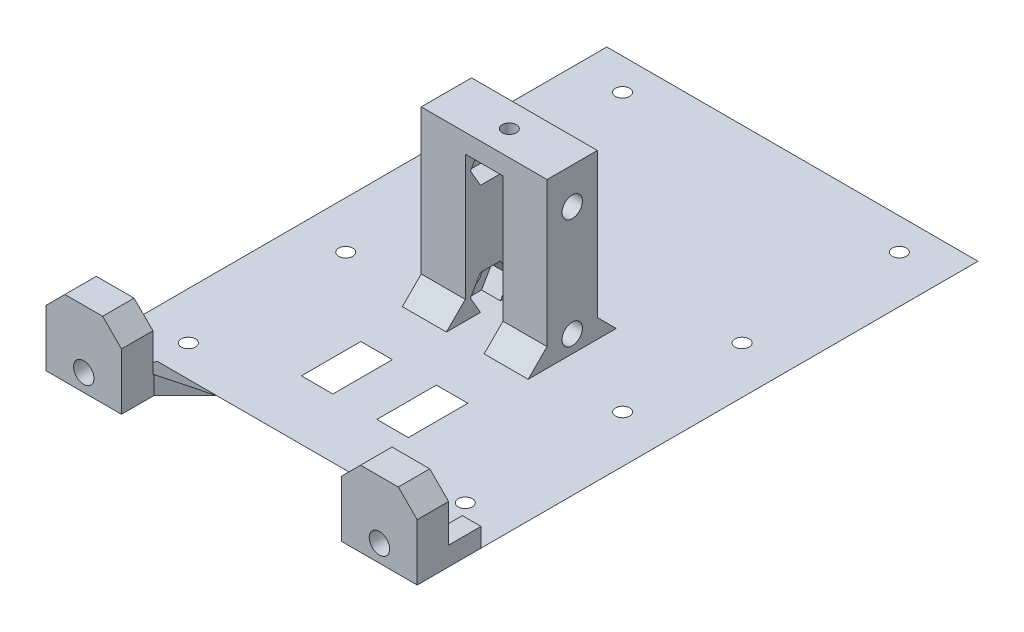
from build123d import *

# Parameters (mm, degrees)
BASE_DEPTH                     = 0.001
SKETCH1_W                      = 20
SKETCH1_H                      = 7
SKETCH1_H_2                    = 8
SKETCH1_W_2                    = 7
SKETCH1_H_3                    = 38.5
SOPORTE_MOTORES_DEPTH          = 23
SOPORTE_PALA_DEPTH             = 84.783035433
SKETCH3_R                      = 1.625
AGUJEROS_MOTORES_DEPTH         = 72.406211399
SKETCH4_R                      = 1
AGUJEROS_PALA_DEPTH            = 4
HUECO_SOPORTE_POSTERIOR_DEPTH  = 10
CORTE_SOPORTE_PALA_MOTOR_REACH = 70.026
BOSS_EXTRUDE2_DEPTH            = 20
CHAMFER1_SIZE                  = 3
CORTAR_EXTRUIR1_DEPTH          = 84.783035433
CORTAR_EXTRUIR1_DEPTH_BACK     = 84.783035433
SALIENTE_EXTRUIR1_START        = -59
SALIENTE_EXTRUIR1_DEPTH        = 12
SALIENTE_EXTRUIR2_DEPTH        = 12
CHAFL_N1_SIZE                  = 5
CROQUIS7_R                     = 1.625
CORTAR_EXTRUIR2_DEPTH          = 12
CORTAR_EXTRUIR3_DEPTH          = 15
CORTAR_EXTRUIR3_DEPTH_BACK     = 2.5
CORTAR_EXTRUIR5_DEPTH          = 85.868726303
CORTAR_EXTRUIR5_DEPTH_BACK     = 85.868726303
CROQUIS10_W                    = 13.75510153
CROQUIS10_H                    = 28.013777128
SALIENTE_EXTRUIR3_START        = -20
CROQUIS11_W                    = 8
CROQUIS11_H                    = 3
SALIENTE_EXTRUIR3_DEPTH        = 20
CORTAR_EXTRUIR6_START          = -11
CROQUIS12_W                    = 6
CROQUIS12_H                    = 23
CORTAR_EXTRUIR6_DEPTH          = 14
CORTAR_EXTRUIR7_DEPTH          = 9
CORTAR_EXTRUIR7_DEPTH_BACK     = 3
CHAFL_N2_SIZE                  = 3
CORTAR_EXTRUIR8_REACH          = 70.84
CROQUIS15_R                    = 1.125
CROQUIS16_R                    = 1.125
CORTAR_EXTRUIR9_DEPTH          = 69.839702957


with BuildPart() as part:
    # Croquis1 → Base (new body)
    with BuildSketch(Plane(origin=(0, 0, 10.887020736), x_dir=(1, 0, 0), z_dir=(0, 1, 0))):
        Polygon((-29.5, 32.640625), (29.5, 32.640625), (29.5, -47.359375), (8.5, -47.359375), (8.5, -27.453125), (3.5, -27.453125), (3.5, -47.359375), (-3.5, -47.359375), (-3.5, -27.453125), (-8.5, -27.453125), (-8.5, -47.359375), (-29.5, -47.359375), align=None)
    extrude(amount=BASE_DEPTH)

    # Sketch1 → Soporte Motores (add)
    with BuildSketch(Plane(origin=(0, 0.001, 10.887020736), x_dir=(1, 0, 0), z_dir=(0, 1, 0))):
        with Locations((0, 19.640625)):
            Rectangle(SKETCH1_W, SKETCH1_H)
        with Locations((0, -12.359375)):
            Rectangle(SKETCH1_W, SKETCH1_H_2)
        with Locations((0, -35.609375)):
            Rectangle(SKETCH1_W_2, SKETCH1_H_3)
    extrude(amount=SOPORTE_MOTORES_DEPTH)

    # Sketch2 → Soporte Pala (cut, through all)
    with BuildSketch(Plane(origin=(29.5, 0, 10.887020736), x_dir=(0, 0, -1), z_dir=(1, 0, 0))):
        Polygon((-54.859375, 23.001), (-46.359375, 0), (-47.359375, 0), (-47.359375, 0.001), (-54.859375, 0.001), align=None)
    extrude(amount=-SOPORTE_PALA_DEPTH, mode=Mode.SUBTRACT)

    # Sketch3 → Agujeros Motores (cut, through all)
    with BuildSketch(Plane(origin=(-10, 0, 10.887020736), x_dir=(0, 0, 1), z_dir=(-1, 0, 0))):
        with Locations((12.359375, 2.751)):
            Circle(SKETCH3_R)
        with Locations((12.359375, 20.251)):
            Circle(SKETCH3_R)
    extrude(amount=-AGUJEROS_MOTORES_DEPTH, mode=Mode.SUBTRACT)

    # Sketch4 → Agujeros pala (cut)
    with BuildSketch(Plane(origin=(0, -15.440118905, 51.540512919), x_dir=(1, 0, 0), z_dir=(0, -0.34663688071515025, 0.9379993992151973))):
        with Locations(Location((0, 21.460691678, 0), (0, 0, 270))):
            Circle(SKETCH4_R)
        with Locations(Location((0, 31.460691678, 0), (0, 0, 270))):
            Circle(SKETCH4_R)
    extrude(amount=-AGUJEROS_PALA_DEPTH, mode=Mode.SUBTRACT)

    # Croquis2 → Hueco Soporte Posterior (cut)
    with BuildSketch(Plane(origin=(0, 0, -12.253604264), x_dir=(-1, 0, 0), z_dir=(0, 0, -1))):
        Polygon((-5, 6), (-5, 0.001), (5, 0.001), (5, 3.001), (5, 18.001), (-5, 18.001), align=None)
    extrude(amount=-HUECO_SOPORTE_POSTERIOR_DEPTH, mode=Mode.SUBTRACT)

    # Croquis3 → Corte_Soporte_PALA_MOTOR (cut, up to next)
    with BuildSketch(Plane(origin=(-3.5, 0, 10.887020736), x_dir=(0, 0, 1), z_dir=(-1, 0, 0)), mode=Mode.PRIVATE) as corte_soporte_pala_motor_sk1:
        Polygon((21.90625, 0.001), (36.90625, 0.001), (36.90625, 23.001), (21.90625, 23.001), (16.359375, 23.001), (16.359375, 0.001), align=None)
    corte_soporte_pala_motor_tool1 = extrude(corte_soporte_pala_motor_sk1.sketch, amount=-CORTE_SOPORTE_PALA_MOTOR_REACH, mode=Mode.PRIVATE) & part.part
    add(corte_soporte_pala_motor_tool1.solids().sort_by_distance((-3.5, 11.501, 37.519833))[0], mode=Mode.SUBTRACT)

    # Sketch5 → Boss-Extrude2 (add)
    with BuildSketch(Plane(origin=(-8.5, 0, 10.887020736), x_dir=(0, 0, -1), z_dir=(1, 0, 0))):
        Polygon((-36.90625, 0.001), (-36.90625, 0), (-46.359375, 0), (-46.359744549, 0.001), align=None)
    extrude(amount=BOSS_EXTRUDE2_DEPTH)

    # Chamfer1
    # the kernel refuses this chamfer: 3 mm, written as the material it adds along each edge
    with BuildSketch(Plane(origin=(10, 0.001, -5.253604264), x_dir=(0, -0.027495876610586372, 0.9996219169112968), z_dir=(-1, 0, 0)), Plane(origin=(5, 0.001, -12.253604264), x_dir=(0, -0.02749587661058642, -0.9996219169112968), z_dir=(1, 0, 0)), Plane(origin=(-5, 0.001, -5.253604264), x_dir=(0, -0.027495876610586372, 0.9996219169112968), z_dir=(-1, 0, 0)), Plane(origin=(-10, 0.001, -12.253604264), x_dir=(0, -0.02749587661058642, -0.9996219169112968), z_dir=(1, 0, 0))) as chamfer1_piece_1:
        Polygon((CHAMFER1_SIZE * 0.999621916911, CHAMFER1_SIZE * 0.0274958766106), (-CHAMFER1_SIZE * 0.0274958766106, CHAMFER1_SIZE * 0.999621916911), (0, 0), align=None)
    extrude(amount=5)
    with BuildSketch(Plane(origin=(-5, 0.001, -12.253604264), x_dir=(0.9996219169112968, -0.027495876610586372, 0), z_dir=(0, 0, 1))) as chamfer1_piece_2:
        Polygon((CHAMFER1_SIZE * 0.999621916911, CHAMFER1_SIZE * 0.0274958766106), (-CHAMFER1_SIZE * 0.0274958766106, CHAMFER1_SIZE * 0.999621916911), (0, 0), align=None)
    extrude(amount=7)
    with BuildSketch(Plane(origin=(5, 0.001, -12.253604264), x_dir=(-0.9996219169112968, -0.02749587661058637, 0), z_dir=(0, 0, 1))) as chamfer1_piece_3:
        Polygon((CHAMFER1_SIZE * 0.999621916911, -CHAMFER1_SIZE * 0.0274958766106), (-CHAMFER1_SIZE * 0.0274958766106, -CHAMFER1_SIZE * 0.999621916911), (0, 0), align=None)
    extrude(amount=7)
    with BuildSketch(Plane(origin=(-3.5, 0.001, 64.961814249), x_dir=(-0.9996219169112969, -0.027495876610586372, 0), z_dir=(0, 0, -1))) as chamfer1_piece_4_section:
        Polygon((CHAMFER1_SIZE * 0.999621916911, CHAMFER1_SIZE * 0.0274958766106), (-CHAMFER1_SIZE * 0.0274958766106, CHAMFER1_SIZE * 0.999621916911), (0, 0), align=None)
    chamfer1_piece_4 = extrude(amount=17.168543513, mode=Mode.PRIVATE)
    chamfer1_piece_4 = split(chamfer1_piece_4, bisect_by=Plane(origin=(-4.440250326, -0.54073931, 57.046565984), z_dir=(0, 0.34663688071515014, -0.9379993992151971)), keep=Keep.TOP, mode=Mode.PRIVATE)
    chamfer1_piece_4 = split(chamfer1_piece_4, bisect_by=Plane(origin=(-4.440250326, 0, 52.715647697), z_dir=(0, 1, 0)), keep=Keep.TOP, mode=Mode.PRIVATE)
    add(chamfer1_piece_4)
    with BuildSketch(Plane(origin=(3.5, 0.001, 47.793270736), x_dir=(0.9996219169112969, -0.027495876610586372, 0), z_dir=(0, 0, 1))) as chamfer1_piece_5_section:
        Polygon((CHAMFER1_SIZE * 0.999621916911, CHAMFER1_SIZE * 0.0274958766106), (-CHAMFER1_SIZE * 0.0274958766106, CHAMFER1_SIZE * 0.999621916911), (0, 0), align=None)
    chamfer1_piece_5 = extrude(amount=17.168543513, mode=Mode.PRIVATE)
    chamfer1_piece_5 = split(chamfer1_piece_5, bisect_by=Plane(origin=(4.440250326, -0.54073931, 57.046565984), z_dir=(0, 0.34663688071515014, -0.9379993992151971)), keep=Keep.TOP, mode=Mode.PRIVATE)
    chamfer1_piece_5 = split(chamfer1_piece_5, bisect_by=Plane(origin=(4.440250326, 0, 52.715647697), z_dir=(0, 1, 0)), keep=Keep.TOP, mode=Mode.PRIVATE)
    add(chamfer1_piece_5)
    with BuildSketch(Plane(origin=(-10, 0.001, 19.246395736), x_dir=(0, -0.02749587661058636, -0.9996219169112968), z_dir=(1, 0, 0)), Plane(origin=(10, 0.001, 27.246395736), x_dir=(0, -0.02749587661058636, 0.9996219169112968), z_dir=(-1, 0, 0))) as chamfer1_piece_6:
        Polygon((CHAMFER1_SIZE * 0.999621916911, CHAMFER1_SIZE * 0.0274958766106), (-CHAMFER1_SIZE * 0.0274958766106, CHAMFER1_SIZE * 0.999621916911), (0, 0), align=None)
    extrude(amount=20)
    with BuildSketch(Plane(origin=(5, 0.001, -12.253604264), x_dir=(-0.9996219169112968, -0.02749587661058637, 0), z_dir=(0, 0, 1))) as chamfer1_piece_7a_section:
        Polygon((CHAMFER1_SIZE * 0.999621916911, -CHAMFER1_SIZE * 0.0274958766106), (-CHAMFER1_SIZE * 0.0274958766106, -CHAMFER1_SIZE * 0.999621916911), (0, 0), align=None)
    chamfer1_piece_7a = extrude(amount=14.715048964, mode=Mode.PRIVATE)
    chamfer1_piece_7a = split(chamfer1_piece_7a, bisect_by=Plane(origin=(4.01061912, 0.99038088, -5.253604264), z_dir=(0, 0, 1)), keep=Keep.TOP, mode=Mode.PRIVATE)
    with BuildSketch(Plane(origin=(10, 0.001, -5.253604264), x_dir=(0, -0.027495876610586372, 0.9996219169112968), z_dir=(-1, 0, 0))) as chamfer1_piece_7b_section:
        Polygon((CHAMFER1_SIZE * 0.999621916911, CHAMFER1_SIZE * 0.0274958766106), (-CHAMFER1_SIZE * 0.0274958766106, CHAMFER1_SIZE * 0.999621916911), (0, 0), align=None)
    chamfer1_piece_7b = extrude(amount=12.715048964, mode=Mode.PRIVATE)
    chamfer1_piece_7b = split(chamfer1_piece_7b, bisect_by=Plane(origin=(5, 0.99038088, -4.264223383), z_dir=(-1, 0, 0)), keep=Keep.TOP, mode=Mode.PRIVATE)
    chamfer1_piece_7 = chamfer1_piece_7a & chamfer1_piece_7b
    add(chamfer1_piece_7)
    with BuildSketch(Plane(origin=(-2.715048964, 0.001, -12.253604264), x_dir=(0, -0.027495876610586358, -0.9996219169112968), z_dir=(1, 0, 0))) as chamfer1_piece_8a_section:
        Polygon((CHAMFER1_SIZE * 0.999621916911, CHAMFER1_SIZE * 0.0274958766106), (-CHAMFER1_SIZE * 0.0274958766106, CHAMFER1_SIZE * 0.999621916911), (0, 0), align=None)
    chamfer1_piece_8a = extrude(amount=12.715048964, mode=Mode.PRIVATE)
    chamfer1_piece_8a = split(chamfer1_piece_8a, bisect_by=Plane(origin=(5, 0.99038088, -13.242985144), z_dir=(-1, 0, 0)), keep=Keep.TOP, mode=Mode.PRIVATE)
    with BuildSketch(Plane(origin=(5, 0.001, -19.968653228), x_dir=(-0.9996219169112968, -0.02749587661058637, 0), z_dir=(0, 0, 1))) as chamfer1_piece_8b_section:
        Polygon((CHAMFER1_SIZE * 0.999621916911, -CHAMFER1_SIZE * 0.0274958766106), (-CHAMFER1_SIZE * 0.0274958766106, -CHAMFER1_SIZE * 0.999621916911), (0, 0), align=None)
    chamfer1_piece_8b = extrude(amount=14.715048964, mode=Mode.PRIVATE)
    chamfer1_piece_8b = split(chamfer1_piece_8b, bisect_by=Plane(origin=(4.01061912, 0.99038088, -12.253604264), z_dir=(0, 0, -1)), keep=Keep.TOP, mode=Mode.PRIVATE)
    chamfer1_piece_8 = chamfer1_piece_8a & chamfer1_piece_8b
    add(chamfer1_piece_8)
    with BuildSketch(Plane(origin=(-10, 0.001, -12.253604264), x_dir=(0, -0.02749587661058642, -0.9996219169112968), z_dir=(1, 0, 0))) as chamfer1_piece_9a_section:
        Polygon((CHAMFER1_SIZE * 0.999621916911, CHAMFER1_SIZE * 0.0274958766106), (-CHAMFER1_SIZE * 0.0274958766106, CHAMFER1_SIZE * 0.999621916911), (0, 0), align=None)
    chamfer1_piece_9a = extrude(amount=12.715048964, mode=Mode.PRIVATE)
    chamfer1_piece_9a = split(chamfer1_piece_9a, bisect_by=Plane(origin=(-5, 0.99038088, -13.242985144), z_dir=(1, 0, 0)), keep=Keep.TOP, mode=Mode.PRIVATE)
    with BuildSketch(Plane(origin=(-5, 0.001, -19.968653228), x_dir=(0.9996219169112968, -0.027495876610586372, 0), z_dir=(0, 0, 1))) as chamfer1_piece_9b_section:
        Polygon((CHAMFER1_SIZE * 0.999621916911, CHAMFER1_SIZE * 0.0274958766106), (-CHAMFER1_SIZE * 0.0274958766106, CHAMFER1_SIZE * 0.999621916911), (0, 0), align=None)
    chamfer1_piece_9b = extrude(amount=14.715048964, mode=Mode.PRIVATE)
    chamfer1_piece_9b = split(chamfer1_piece_9b, bisect_by=Plane(origin=(-4.01061912, 0.99038088, -12.253604264), z_dir=(0, 0, -1)), keep=Keep.TOP, mode=Mode.PRIVATE)
    chamfer1_piece_9 = chamfer1_piece_9a & chamfer1_piece_9b
    add(chamfer1_piece_9)
    with BuildSketch(Plane(origin=(2.715048964, 0.001, -5.253604264), x_dir=(0, -0.027495876610586372, 0.9996219169112968), z_dir=(-1, 0, 0))) as chamfer1_piece_10a_section:
        Polygon((CHAMFER1_SIZE * 0.999621916911, CHAMFER1_SIZE * 0.0274958766106), (-CHAMFER1_SIZE * 0.0274958766106, CHAMFER1_SIZE * 0.999621916911), (0, 0), align=None)
    chamfer1_piece_10a = extrude(amount=12.715048964, mode=Mode.PRIVATE)
    chamfer1_piece_10a = split(chamfer1_piece_10a, bisect_by=Plane(origin=(-5, 0.99038088, -4.264223383), z_dir=(1, 0, 0)), keep=Keep.TOP, mode=Mode.PRIVATE)
    with BuildSketch(Plane(origin=(-5, 0.001, -12.253604264), x_dir=(0.9996219169112968, -0.027495876610586372, 0), z_dir=(0, 0, 1))) as chamfer1_piece_10b_section:
        Polygon((CHAMFER1_SIZE * 0.999621916911, CHAMFER1_SIZE * 0.0274958766106), (-CHAMFER1_SIZE * 0.0274958766106, CHAMFER1_SIZE * 0.999621916911), (0, 0), align=None)
    chamfer1_piece_10b = extrude(amount=14.715048964, mode=Mode.PRIVATE)
    chamfer1_piece_10b = split(chamfer1_piece_10b, bisect_by=Plane(origin=(-4.01061912, 0.99038088, -5.253604264), z_dir=(0, 0, 1)), keep=Keep.TOP, mode=Mode.PRIVATE)
    chamfer1_piece_10 = chamfer1_piece_10a & chamfer1_piece_10b
    add(chamfer1_piece_10)

    # Croquis4 → Cortar-Extruir1 (cut, two sides: drawn at the far end of the back side and taken through both)
    with BuildSketch(Plane(origin=(-29.5, 0, 10.887020736), x_dir=(0, 0, 1), z_dir=(-1, 0, 0)).offset(-CORTAR_EXTRUIR1_DEPTH_BACK)):
        Polygon((36.90625, 23.001), (36.90625, 0.001), (46.359375, 0.001), (46.359375, 0), (54.859375, 23.001), align=None)
    extrude(amount=CORTAR_EXTRUIR1_DEPTH + CORTAR_EXTRUIR1_DEPTH_BACK, mode=Mode.SUBTRACT)

    # Croquis5 → Saliente-Extruir1 (add)
    with BuildSketch(Plane(origin=(-29.5, 0, 10.887020736), x_dir=(0, 0, 1), z_dir=(-1, 0, 0)).offset(SALIENTE_EXTRUIR1_START)):
        Polygon((46.359375, 0), (56.503581331, 0), (56.503581331, 12), (51.503581331, 12), (51.503581331, 3.001), (46.359375, 3), align=None)
    extrude(amount=SALIENTE_EXTRUIR1_DEPTH)

    # Croquis6 → Saliente-Extruir2 (add)
    with BuildSketch(Plane(origin=(-29.5, 0, 10.887020736), x_dir=(0, 0, 1), z_dir=(-1, 0, 0))):
        Polygon((46.359375, 0.001), (46.359375, 0), (56.503581331, 0), (56.503581331, 12), (51.503581331, 12), (51.503581331, 3.001), align=None)
    extrude(amount=-SALIENTE_EXTRUIR2_DEPTH)

    # Chaflán1
    chafl_n1_edges = [part.edges().sort_by_distance(p)[0] for p in [
        (-17.5, 0.0005, 57.246395736),
        (17.5, 0.0005, 57.246395736),
    ]]
    chamfer(chafl_n1_edges, length=CHAFL_N1_SIZE)

    # Croquis7 → Cortar-Extruir2 (cut)
    with BuildSketch(Plane.XY.offset(67.390602068)):
        with Locations((-23.5, 2.751)):
            Circle(CROQUIS7_R)
        with Locations(Location((23.5, 2.751, 0), (0, 0, 8.814201063))):
            Circle(CROQUIS7_R)
    extrude(amount=-CORTAR_EXTRUIR2_DEPTH, mode=Mode.SUBTRACT)

    # Croquis8 → Cortar-Extruir3 (cut, two sides: drawn at the far end of the back side and taken through both)
    with BuildSketch(Plane(origin=(0, 0, 62.390602068), x_dir=(-1, 0, 0), z_dir=(0, 0, -1)).offset(-CORTAR_EXTRUIR3_DEPTH_BACK)):
        Polygon((-21.91228676, 0.001), (-20.324573519, 2.751), (-21.91228676, 5.501), (-25.08771324, 5.501), (-26.675426481, 2.751), (-25.08771324, 0.001), align=None)
        Polygon((25.08771324, 0.001), (26.675426481, 2.751), (25.08771324, 5.501), (21.91228676, 5.501), (20.324573519, 2.751), (21.91228676, 0.001), align=None)
    extrude(amount=CORTAR_EXTRUIR3_DEPTH + CORTAR_EXTRUIR3_DEPTH_BACK, mode=Mode.SUBTRACT)

    # Croquis10 → Cortar-Extruir5 (cut, two sides: drawn at the far end of the back side and taken through both)
    with BuildSketch(Plane(origin=(-29.5, 0, 10.887020736), x_dir=(0, 0, 1), z_dir=(-1, 0, 0)).offset(-CORTAR_EXTRUIR5_DEPTH_BACK)):
        with Locations((-19.263074235, 14.007888564)):
            Rectangle(CROQUIS10_W, CROQUIS10_H)
    extrude(amount=CORTAR_EXTRUIR5_DEPTH + CORTAR_EXTRUIR5_DEPTH_BACK, mode=Mode.SUBTRACT)

    # Croquis11 → Saliente-Extruir3 (add)
    with BuildSketch(Plane(origin=(-10, 0, 10.887020736), x_dir=(0, 0, 1), z_dir=(-1, 0, 0)).offset(SALIENTE_EXTRUIR3_START)):
        with Locations((12.359375, 24.501)):
            Rectangle(CROQUIS11_W, CROQUIS11_H)
    extrude(amount=SALIENTE_EXTRUIR3_DEPTH)

    # Croquis12 → Cortar-Extruir6 (cut)
    with BuildSketch(Plane(origin=(0, 0, 19.246395736), x_dir=(-1, 0, 0), z_dir=(0, 0, -1)).offset(CORTAR_EXTRUIR6_START)):
        with Locations((0, 11.501)):
            Rectangle(CROQUIS12_W, CROQUIS12_H)
    extrude(amount=CORTAR_EXTRUIR6_DEPTH, mode=Mode.SUBTRACT)

    # Croquis13 → Cortar-Extruir7 (cut, two sides: drawn at the far end of the back side and taken through both)
    with BuildSketch(Plane(origin=(3, 0, 10.887020736), x_dir=(0, 0, 1), z_dir=(-1, 0, 0)).offset(-CORTAR_EXTRUIR7_DEPTH_BACK)):
        Polygon((13.94708824, 0.001), (15.534801481, 2.751), (13.94708824, 5.501), (10.77166176, 5.501), (9.183948519, 2.751), (10.77166176, 0.001), align=None)
        Polygon((13.94708824, 17.501), (15.534801481, 20.251), (13.94708824, 23.001), (10.77166176, 23.001), (9.183948519, 20.251), (10.77166176, 17.501), align=None)
    extrude(amount=CORTAR_EXTRUIR7_DEPTH + CORTAR_EXTRUIR7_DEPTH_BACK, mode=Mode.SUBTRACT)

    # Chaflán2
    chafl_n2_edges = [part.edges().sort_by_distance(p)[0] for p in [
        (29.5, 12, 64.890602068),
        (17.5, 12, 64.890602068),
        (-17.5, 12, 64.890602068),
        (-29.5, 12, 64.890602068),
    ]]
    chamfer(chafl_n2_edges, length=CHAFL_N2_SIZE)

    # Croquis15 → Cortar-Extruir8 (cut, up to next)
    with BuildSketch(Plane(origin=(0, 26.001, 10.887020736), x_dir=(1, 0, 0), z_dir=(0, 1, 0)), mode=Mode.PRIVATE) as cortar_extruir8_sk1:
        with Locations(Location((0, -12.359375, 0), (0, 0, 270))):
            Circle(CROQUIS15_R)
    cortar_extruir8_tool1 = extrude(cortar_extruir8_sk1.sketch, amount=-CORTAR_EXTRUIR8_REACH, mode=Mode.PRIVATE) & part.part
    add(cortar_extruir8_tool1.solids().sort_by_distance((0, 26.001, 23.246396))[0], mode=Mode.SUBTRACT)

    # Croquis16 → Cortar-Extruir9 (cut, through all)
    with BuildSketch(Plane(origin=(0, 0.001, 10.887020736), x_dir=(1, 0, 0), z_dir=(0, 1, 0))):
        with Locations(Location((-22, -41.359375, 0), (0, 0, 270))):
            Circle(CROQUIS16_R)
        with Locations(Location((22, -41.359375, 0), (0, 0, 270))):
            Circle(CROQUIS16_R)
        with Locations(Location((-22, 2.640625, 0), (0, 0, 270))):
            Circle(CROQUIS16_R)
        with Locations(Location((22, 2.640625, 0), (0, 0, 270))):
            Circle(CROQUIS16_R)
        with Locations(Location((-22, 27.640625, 0), (0, 0, 270))):
            Circle(CROQUIS16_R)
        with Locations(Location((22, 27.640625, 0), (0, 0, 270))):
            Circle(CROQUIS16_R)
        with Locations(Location((-22, -16.359375, 0), (0, 0, 270))):
            Circle(CROQUIS16_R)
        with Locations(Location((22, -16.359375, 0), (0, 0, 270))):
            Circle(CROQUIS16_R)
    extrude(amount=-CORTAR_EXTRUIR9_DEPTH, mode=Mode.SUBTRACT)


solid = part.part
